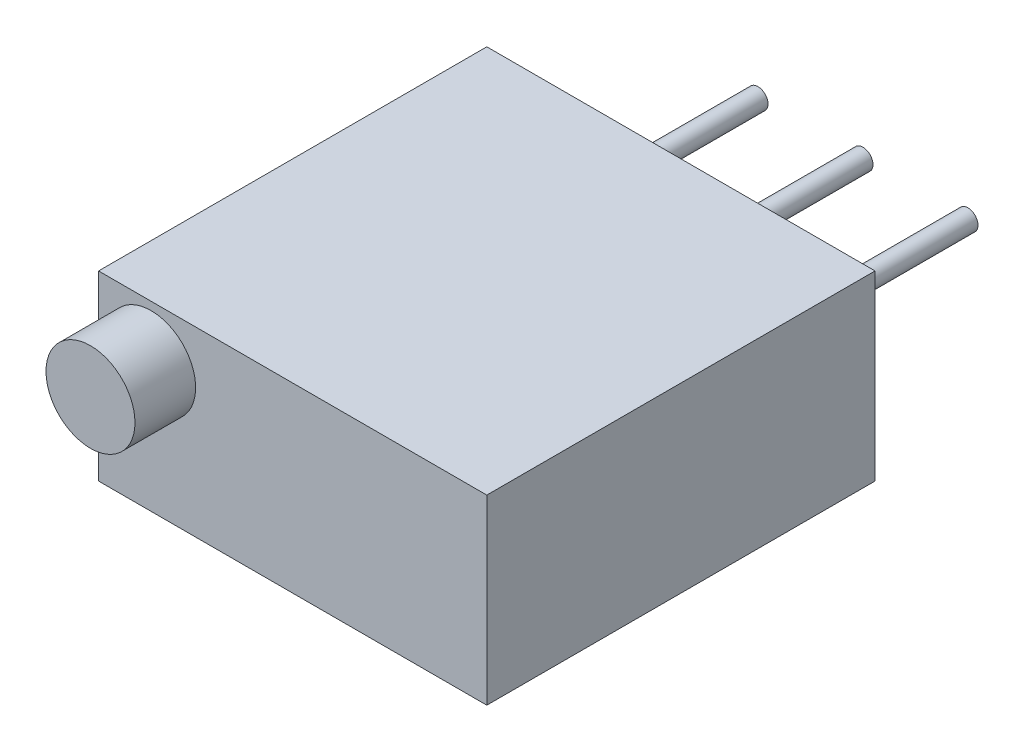
from build123d import *

# Parameters (mm, degrees)
SKETCH_1_W        = 9.6
SKETCH_1_H        = 9.6
EXTRUDE_1_DEPTH   = 4.5
SKETCH_3_R        = 0.25
EXTRUDE_3_DEPTH   = 4.5
EXTRUDE_1_2_DEPTH = 1.5


with BuildPart() as part:
    # 草图1 → Extrude 1 (new body)
    with BuildSketch(Plane(origin=(0, 0, 0), x_dir=(1, 0, 0), z_dir=(0, 1, 0))):
        Rectangle(SKETCH_1_W, SKETCH_1_H)
    extrude(amount=EXTRUDE_1_DEPTH)

    # 草图3 → 拉伸3 (add)
    with BuildSketch(Plane(origin=(0, 0, -4.8), x_dir=(-1, 0, 0), z_dir=(0, 0, -1))):
        with Locations((0, 2.25)):
            Circle(SKETCH_3_R)
        with Locations((2.595978382, 2.25)):
            Circle(SKETCH_3_R)
        with Locations((-2.595978382, 2.25)):
            Circle(SKETCH_3_R)
    extrude(amount=EXTRUDE_3_DEPTH)

    # 草图4 → Extrude 1 2 (add)
    with BuildSketch(Plane.XY.offset(4.8)):
        with BuildLine():
            ThreePointArc((-4.6, 3.2), (-3.5, 2.1), (-2.4, 3.2))
            ThreePointArc((-2.4, 3.2), (-3.5, 4.3), (-4.6, 3.2))
        make_face()
    extrude(amount=EXTRUDE_1_2_DEPTH)


solid = part.part
